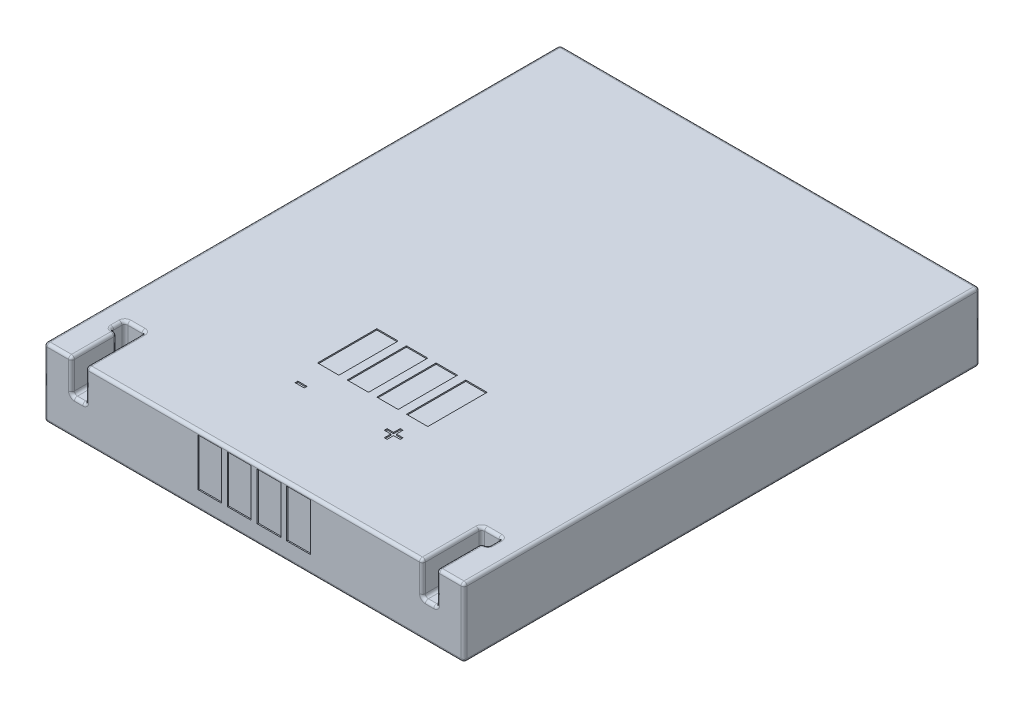
from build123d import *

# Parameters (mm, degrees)
SKETCH1_W           = 35.4
SKETCH1_H           = 43.5
BOSS_EXTRUDE1_DEPTH = 2.9
CUT_EXTRUDE1_DEPTH  = 2.8
SKETCH3_W           = 1.8
SKETCH3_H           = 5
SKETCH3_W_2         = 0.763910173
SKETCH3_H_2         = 0.237075571
CUT_EXTRUDE2_DEPTH  = 0.1
SKETCH4_W           = 2
SKETCH4_H           = 4
CUT_EXTRUDE3_DEPTH  = 0.1
FILLET1_R           = 0.25


with BuildPart() as part:
    # Sketch1 → Boss-Extrude1 (new, symmetric)
    with BuildSketch(Plane(origin=(0, 0, 0), x_dir=(1, 0, 0), z_dir=(0, 1, 0))):
        Rectangle(SKETCH1_W, SKETCH1_H)
    extrude(amount=BOSS_EXTRUDE1_DEPTH, both=True)

    # Sketch2 → Cut-Extrude1 (cut)
    with BuildSketch(Plane(origin=(0, 2.9, 0), x_dir=(1, 0, 0), z_dir=(0, 1, 0))):
        Polygon((-14.2, -21.75), (-14.2, -16.75), (-15.9, -16.75), (-15.9, -17.95), (-15.4, -17.95), (-15.4, -21.75), align=None)
        Polygon((15.4, -21.75), (14.2, -21.75), (14.2, -16.75), (15.9, -16.75), (15.9, -17.95), (15.4, -17.95), align=None)
    extrude(amount=-CUT_EXTRUDE1_DEPTH, mode=Mode.SUBTRACT)

    # Sketch3 → Cut-Extrude2 (cut)
    with BuildSketch(Plane(origin=(0, 2.9, 0), x_dir=(1, 0, 0), z_dir=(0, 1, 0))):
        with Locations((-3.75, -9.25)):
            Rectangle(SKETCH3_W, SKETCH3_H)
        with Locations((-1.25, -9.25)):
            Rectangle(SKETCH3_W, SKETCH3_H)
        with Locations((1.25, -9.25)):
            Rectangle(SKETCH3_W, SKETCH3_H)
        with Locations((3.75, -9.25)):
            Rectangle(SKETCH3_W, SKETCH3_H)
        with Locations((-3.763170866, -14.025602423)):
            Rectangle(SKETCH3_W_2, SKETCH3_H_2)
        Polygon((3.631462215, -14.407557509), (3.631462215, -13.854381177), (3.078285882, -13.854381177), (3.078285882, -13.617305606), (3.631462215, -13.617305606), (3.631462215, -13.064129274), (3.868537785, -13.064129274), (3.868537785, -13.617305606), (4.421714118, -13.617305606), (4.421714118, -13.854381177), (3.868537785, -13.854381177), (3.868537785, -14.407557509), align=None)
    extrude(amount=-CUT_EXTRUDE2_DEPTH, mode=Mode.SUBTRACT)

    # Sketch4 → Cut-Extrude3 (cut)
    with BuildSketch(Plane.XY.offset(21.75)):
        with Locations((-3.75, 0.6)):
            Rectangle(SKETCH4_W, SKETCH4_H)
        with Locations((-1.25, 0.6)):
            Rectangle(SKETCH4_W, SKETCH4_H)
        with Locations((1.25, 0.6)):
            Rectangle(SKETCH4_W, SKETCH4_H)
        with Locations((3.75, 0.6)):
            Rectangle(SKETCH4_W, SKETCH4_H)
    extrude(amount=-CUT_EXTRUDE3_DEPTH, mode=Mode.SUBTRACT)

    # Fillet1
    fillet1_edges = [part.edges().sort_by_distance(p)[0] for p in [
        (17.7, 2.9, 0),
        (0, 2.9, -21.75),
        (0, 2.9, 21.75),
        (-14.8, 0.1, 21.75),
        (-14.2, 1.5, 21.75),
        (-15.4, 0.1, 19.85),
        (-15.4, 1.5, 21.75),
        (-15.65, 0.1, 17.95),
        (-15.4, 1.5, 17.95),
        (-15.9, 0.1, 17.35),
        (-15.9, 1.5, 17.95),
        (-15.05, 0.1, 16.75),
        (-15.9, 1.5, 16.75),
        (-14.2, 0.1, 19.25),
        (-14.2, 1.5, 16.75),
        (-14.2, 2.9, 19.25),
        (-15.05, 2.9, 16.75),
        (-15.9, 2.9, 17.35),
        (-15.65, 2.9, 17.95),
        (-15.4, 2.9, 19.85),
        (16.55, 2.9, 21.75),
        (15.4, 0.1, 19.85),
        (15.4, 1.5, 17.95),
        (14.8, 0.1, 21.75),
        (15.4, 1.5, 21.75),
        (14.2, 0.1, 19.25),
        (14.2, 1.5, 21.75),
        (15.05, 0.1, 16.75),
        (14.2, 1.5, 16.75),
        (15.9, 0.1, 17.35),
        (15.9, 1.5, 16.75),
        (15.65, 0.1, 17.95),
        (15.9, 1.5, 17.95),
        (15.4, 2.9, 19.85),
        (15.65, 2.9, 17.95),
        (15.9, 2.9, 17.35),
        (15.05, 2.9, 16.75),
        (14.2, 2.9, 19.25),
        (-17.7, 2.9, 0),
        (0, -2.9, -21.75),
        (17.7, -2.9, 0),
        (0, -2.9, 21.75),
        (-17.7, -2.9, 0),
        (-16.55, 2.9, 21.75),
        (-17.7, 0, -21.75),
        (17.7, 0, -21.75),
        (17.7, 0, 21.75),
        (-17.7, 0, 21.75),
    ]]
    fillet(fillet1_edges, radius=FILLET1_R - 0.0001)  # a hair under: the kernel refuses the full size


solid = part.part
